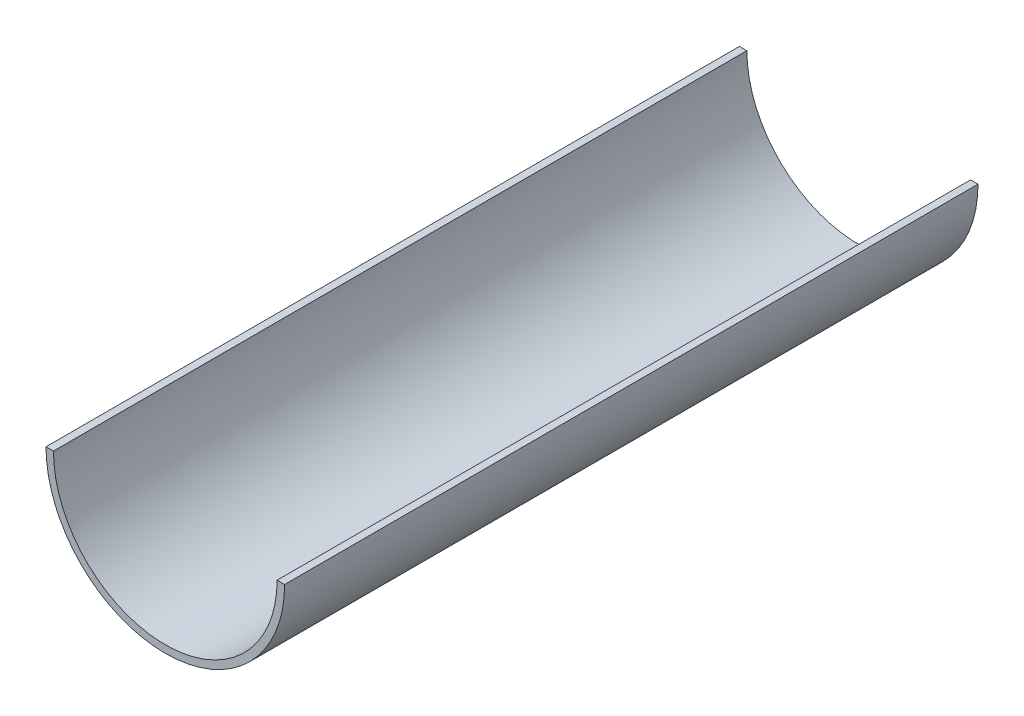
from build123d import *

# Parameters (mm, degrees)
SALIENTE_EXTRUIR1_DEPTH = 93


with BuildPart() as part:
    # Croquis1 → Saliente-Extruir1 (new body)
    with BuildSketch(Plane.XY):
        with BuildLine():
            Line((-16, 0), (-15, 0))
            ThreePointArc((-15, 0), (0, -15), (15, 0))
            Line((15, 0), (16, 0))
            ThreePointArc((16, 0), (0, -16), (-16, 0))
        make_face()
    extrude(amount=SALIENTE_EXTRUIR1_DEPTH)


solid = part.part
